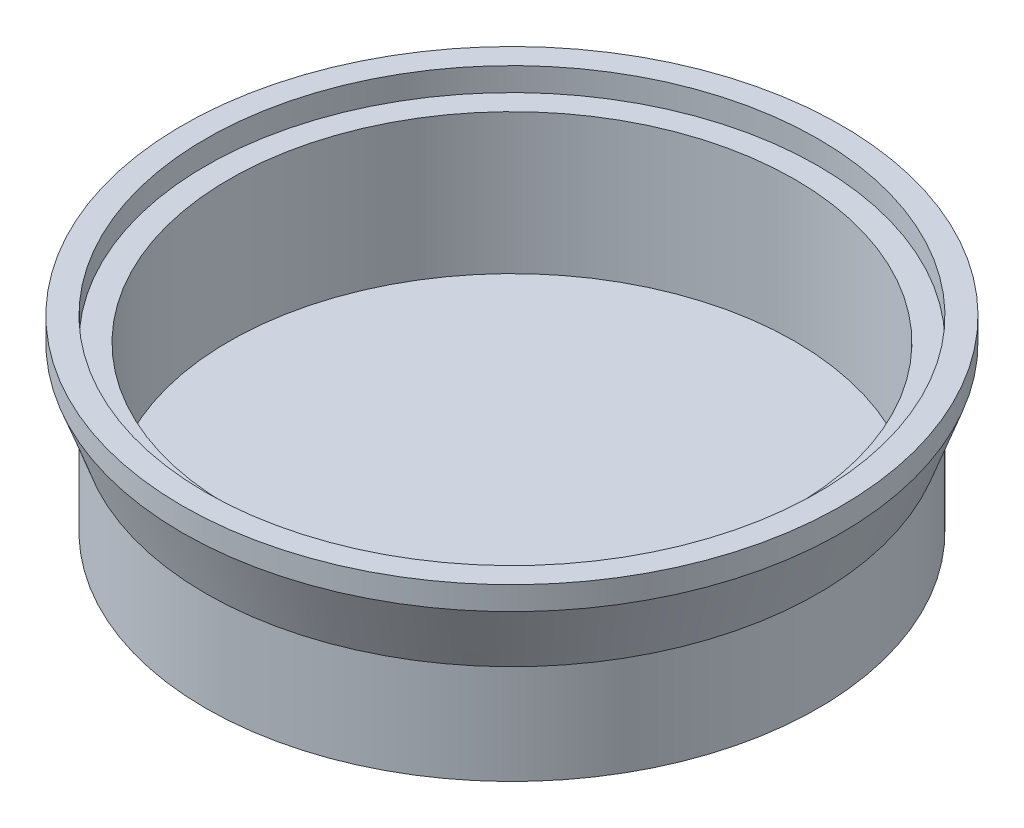
from build123d import *


with BuildPart() as part:
    # Sketch1 → Revolve1 (revolve)
    with BuildSketch(Plane.XY):
        Polygon((-65.5, 0), (0, 0), (0, 5), (-60.5, 5), (-60.5, 35), (-65.5, 35), (-65.5, 40), (-70.5, 40), (-70.5, 35), (-65.5, 21.262612903), align=None)
    revolve(axis=Axis((0, 5, 0), (0, -1, 0)))


solid = part.part
